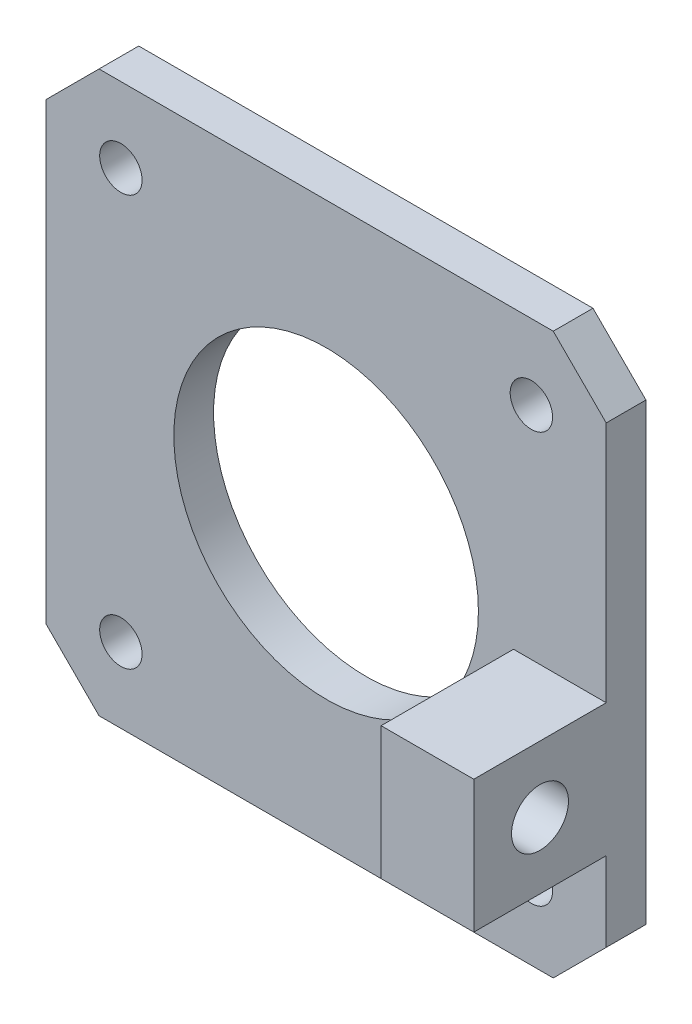
from build123d import *

# Parameters (mm, degrees)
CROQUIS1_R              = 1.6
CROQUIS1_R_2            = 11.5
SALIENTE_EXTRUIR1_DEPTH = 3
CROQUIS2_W              = 10
CROQUIS2_H              = 10
CROQUIS2_R              = 2.15
SALIENTE_EXTRUIR2_DEPTH = 7


with BuildPart() as part:
    # Croquis1 → Saliente-Extruir1 (new body)
    with BuildSketch(Plane.XY):
        Polygon((21.15, 17.15), (17.15, 21.15), (-17.15, 21.15), (-21.15, 17.15), (-21.15, -17.15), (-17.15, -21.15), (17.15, -21.15), (21.15, -17.15), align=None)
        with Locations((-15.5, 15.5)):
            Circle(CROQUIS1_R, mode=Mode.SUBTRACT)
        with Locations((-15.5, -15.5)):
            Circle(CROQUIS1_R, mode=Mode.SUBTRACT)
        with Locations((15.5, 15.5)):
            Circle(CROQUIS1_R, mode=Mode.SUBTRACT)
        with Locations((15.5, -15.5)):
            Circle(CROQUIS1_R, mode=Mode.SUBTRACT)
        Circle(CROQUIS1_R_2, mode=Mode.SUBTRACT)
    extrude(amount=SALIENTE_EXTRUIR1_DEPTH)

    # Croquis2 → Saliente-Extruir2 (add)
    with BuildSketch(Plane(origin=(21.15, 0, 0), x_dir=(0, 0, -1), z_dir=(1, 0, 0))):
        with Locations((-8, -6.15)):
            Rectangle(CROQUIS2_W, CROQUIS2_H)
        with Locations((-8, -6.15)):
            Circle(CROQUIS2_R, mode=Mode.SUBTRACT)
    extrude(amount=-SALIENTE_EXTRUIR2_DEPTH)


solid = part.part
